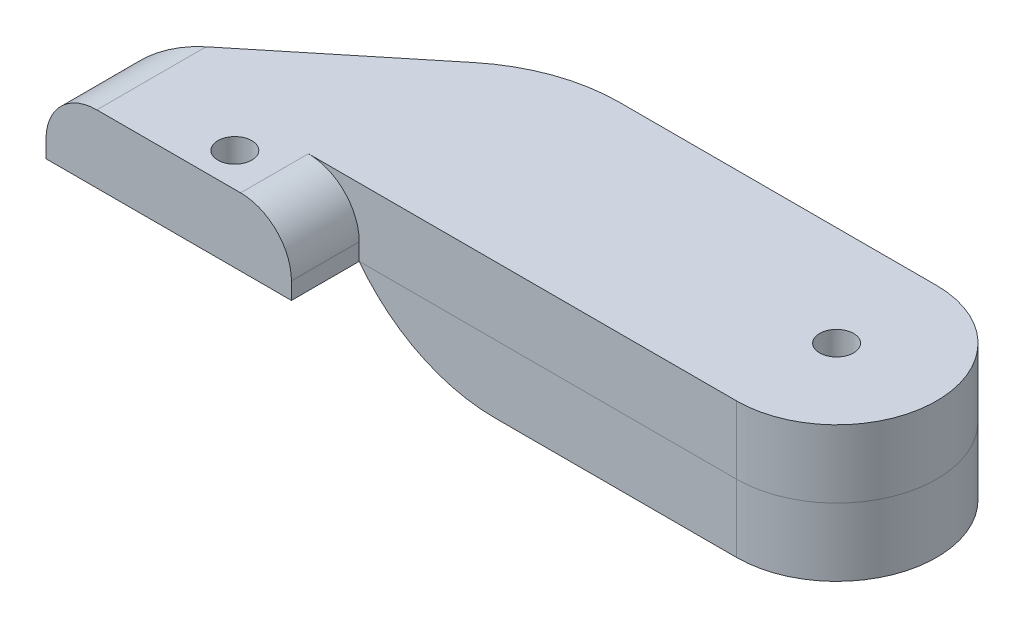
from build123d import *

# Parameters (mm, degrees)
BOSS_EXTRUDE2_DEPTH = 4
BOSS_EXTRUDE3_DEPTH = 4
CUT_EXTRUDE1_DEPTH  = 4
SKETCH7_R           = 1
CUT_EXTRUDE2_DEPTH  = 51.104542171
SKETCH9_R           = 1
CUT_EXTRUDE8_DEPTH  = 51.581272683
FILLET1_R           = 10
FILLET2_R           = 10
FILLET3_R           = 3


with BuildPart() as part:
    # Sketch1 → Boss-Extrude2 (new body)
    with BuildSketch(Plane(origin=(0, 0, 0), x_dir=(1, 0, 0), z_dir=(0, 1, 0))):
        with BuildLine():
            Line((5.357809991, 1.999476122), (19.837809991, 13.8))
            Line((19.837809991, 13.8), (42.1, 13.8))
            ThreePointArc((42.1, 13.8), (48.000261939, 7.899738061), (42.1, 1.999476122))
            Line((42.1, 1.999476122), (19.837809991, 1.999476122))
            Line((19.837809991, 1.999476122), (19.837809991, -1.999476122))
            Line((19.837809991, -1.999476122), (5.357809991, -1.999476122))
            Line((5.357809991, -1.999476122), (5.357809991, 1.999476122))
        make_face()
    extrude(amount=BOSS_EXTRUDE2_DEPTH)

    # Sketch4 → Boss-Extrude3 (add)
    with BuildSketch(Plane(origin=(0, 0, 0), x_dir=(-1, 0, 0), z_dir=(0, -1, 0))):
        with BuildLine():
            Line((-19.837809991, 2), (-42.1, 2))
            ThreePointArc((-42.1, 2), (-48, 7.9), (-42.1, 13.8))
            Line((-42.1, 13.8), (-19.837809991, 13.8))
            Line((-19.837809991, 13.8), (-19.837809991, 2))
        make_face()
    extrude(amount=BOSS_EXTRUDE3_DEPTH)

    # Sketch6 → Cut-Extrude1 (cut)
    with BuildSketch(Plane.XZ.offset(4)):
        with BuildLine():
            Line((39.868301502, -4.92331906), (27.984789323, -5.906817464))
            ThreePointArc((27.984789323, -5.906817464), (25.991606786, -7.9), (27.984789323, -9.893182536))
            Line((27.984789323, -9.893182536), (39.867781655, -10.876291126))
            ThreePointArc((39.867781655, -10.876291126), (45.820363894, -7.900324883), (39.868301502, -4.92331906))
        make_face()
    extrude(amount=-CUT_EXTRUDE1_DEPTH, mode=Mode.SUBTRACT)

    # Sketch7 → Cut-Extrude2 (cut, through all)
    with BuildSketch(Plane.XZ):
        with Locations(Location((42.1, -7.9, 0), (0, 0, 270))):
            Circle(SKETCH7_R)
    extrude(amount=-CUT_EXTRUDE2_DEPTH, mode=Mode.SUBTRACT)

    # Sketch9 → Cut-Extrude8 (cut, through all)
    with BuildSketch(Plane(origin=(0, 4, 0), x_dir=(1, 0, 0), z_dir=(0, 1, 0))):
        with Locations(Location((14.5, 0, 0), (0, 0, 270))):
            Circle(SKETCH9_R)
    extrude(amount=-CUT_EXTRUDE8_DEPTH, mode=Mode.SUBTRACT)

    # Fillet1
    # the kernel refuses this fillet: 10 mm, written as the material it takes off along each edge
    with BuildSketch(Plane(origin=(19.837809991, -4, -33.8), x_dir=(1, 0, 0), z_dir=(0, 0, 1))) as fillet1_piece_1:
        with BuildLine():
            CenterArc((8, 10), FILLET1_R, 216.869897646, 53.130102354)
            Line((0, 4), (-0.16, 3.88))
            ThreePointArc((-0.16, 3.88), (-0.2, 2), (-0.2, 0))
            Line((-0.2, 0), (0, -0.2))
            Line((0, -0.2), (8, -0.2))
            Line((8, -0.2), (8, 0))
        make_face()
    extrude(amount=51.8, mode=Mode.SUBTRACT)

    # Fillet2
    fillet2_edges = [part.edges().sort_by_distance(p)[0] for p in [
        (19.837809991, 2, -13.8),
    ]]
    fillet(fillet2_edges, radius=FILLET2_R)

    # Fillet3
    fillet3_edges = [part.edges().sort_by_distance(p)[0] for p in [
        (5.357809991, 4, 0),
        (19.837809991, 4, 0),
    ]]
    fillet(fillet3_edges, radius=FILLET3_R)


solid = part.part
